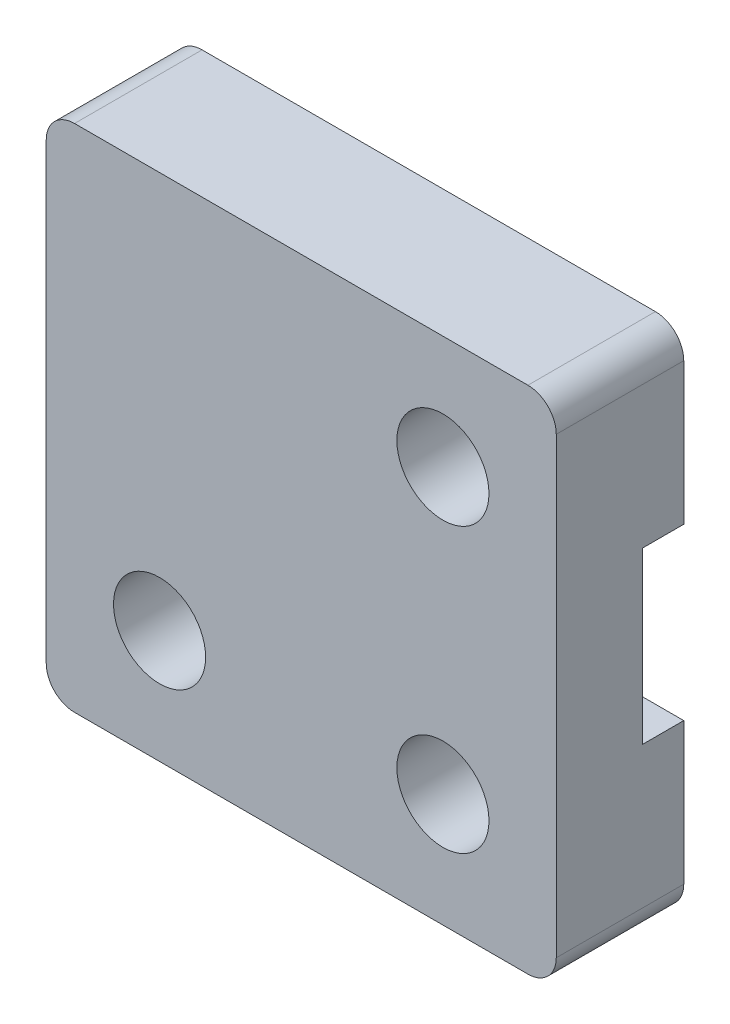
from build123d import *
from build123d.topology import SkipClean

# Parameters (mm, degrees)
SKETCH1_W           = 18
SKETCH1_H           = 18
SKETCH1_R           = 1.625
BOSS_EXTRUDE1_DEPTH = 4
SKETCH2_W           = 1
SKETCH2_H           = 6
CUT_EXTRUDE1_DEPTH  = 0.95
BOSS_EXTRUDE2_START = 0.5
SKETCH3_W           = 18
SKETCH3_H           = 6
SKETCH3_R           = 1.625
BOSS_EXTRUDE2_DEPTH = 0.5
FILLET1_R           = 1


with BuildPart() as part:
    # Sketch1 → Boss-Extrude1 (new body)
    with BuildSketch(Plane.XY):
        with Locations((9, 9)):
            Rectangle(SKETCH1_W, SKETCH1_H)
        with Locations((4, 4)):
            Circle(SKETCH1_R, mode=Mode.SUBTRACT)
        with Locations((14, 4)):
            Circle(SKETCH1_R, mode=Mode.SUBTRACT)
        with Locations((14, 14)):
            Circle(SKETCH1_R, mode=Mode.SUBTRACT)
    extrude(amount=BOSS_EXTRUDE1_DEPTH)

    # Sketch2 → Cut-Extrude1 (cut)
    with BuildSketch(Plane(origin=(0, 0, 0), x_dir=(-1, 0, 0), z_dir=(0, 0, -1))):
        with Locations((-17.5, 9)):
            Rectangle(SKETCH2_W, SKETCH2_H)
        with Locations((-15.5, 9)):
            Rectangle(SKETCH2_W, SKETCH2_H)
        with Locations((-13.5, 9)):
            Rectangle(SKETCH2_W, SKETCH2_H)
        with Locations((-11.5, 9)):
            Rectangle(SKETCH2_W, SKETCH2_H)
        with Locations((-9.5, 9)):
            Rectangle(SKETCH2_W, SKETCH2_H)
        with Locations((-7.5, 9)):
            Rectangle(SKETCH2_W, SKETCH2_H)
        with Locations((-5.5, 9)):
            Rectangle(SKETCH2_W, SKETCH2_H)
        with Locations((-3.5, 9)):
            Rectangle(SKETCH2_W, SKETCH2_H)
        with Locations((-1.5, 9)):
            Rectangle(SKETCH2_W, SKETCH2_H)
    extrude(amount=-CUT_EXTRUDE1_DEPTH, mode=Mode.SUBTRACT)

    # Sketch3 → Boss-Extrude2 (add)
    # profile 1 of 2: a face of its own
    with SkipClean():  # the faces are left unmerged after this step: merging them gives an invalid solid
        with BuildSketch(Plane(origin=(0, 0, 0), x_dir=(-1, 0, 0), z_dir=(0, 0, -1)).offset(BOSS_EXTRUDE2_START)):
            with Locations((-9, 15)):
                Rectangle(SKETCH3_W, SKETCH3_H)
            with Locations((-14, 14)):
                Circle(SKETCH3_R, mode=Mode.SUBTRACT)
        # profile 2 of 2: a face of its own
        with BuildSketch(Plane(origin=(0, 0, 0), x_dir=(-1, 0, 0), z_dir=(0, 0, -1)).offset(BOSS_EXTRUDE2_START)):
            with Locations((-9, 3)):
                Rectangle(SKETCH3_W, SKETCH3_H)
            with Locations((-14, 4)):
                Circle(SKETCH3_R, mode=Mode.SUBTRACT)
            with Locations((-4, 4)):
                Circle(SKETCH3_R, mode=Mode.SUBTRACT)
        extrude(amount=-BOSS_EXTRUDE2_DEPTH)

    # Fillet1
    fillet1_edges = [part.edges().sort_by_distance(p)[0] for p in [
        (0, 0, 2),
        (18, 0, 2),
        (18, 18, 2),
        (0, 18, 2),
    ]]
    fillet(fillet1_edges, radius=FILLET1_R)


solid = part.part
